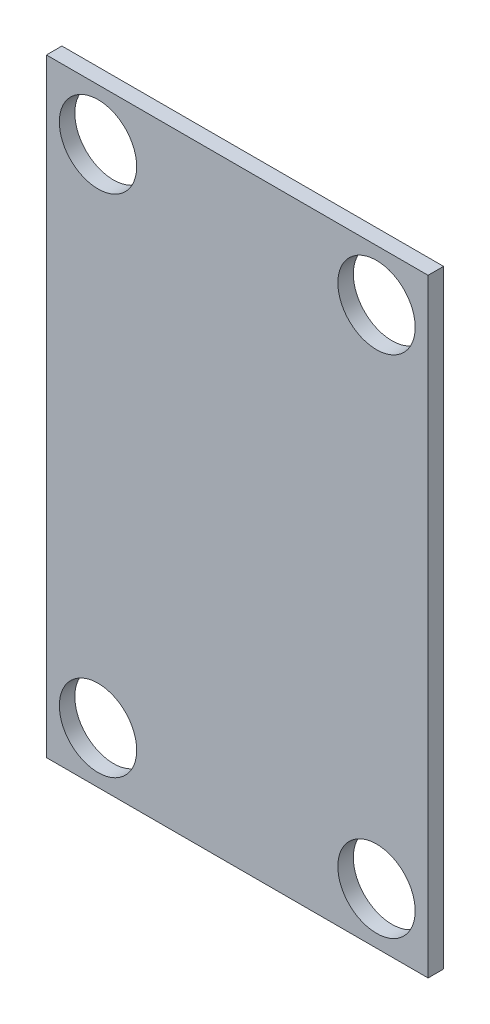
from build123d import *

# Parameters (mm, degrees)
SKETCH_1_W      = 37
SKETCH_1_H      = 59
SKETCH_1_R      = 3.75
EXTRUDE_1_DEPTH = 1.5


with BuildPart() as part:
    # Эскиз1 → Бобышка-Вытянуть1 (new body)
    with BuildSketch(Plane.XY):
        with Locations((0, -31)):
            Rectangle(SKETCH_1_W, SKETCH_1_H)
        with Locations((-13.5, -55.5)):
            Circle(SKETCH_1_R, mode=Mode.SUBTRACT)
        with Locations((13.5, -55.5)):
            Circle(SKETCH_1_R, mode=Mode.SUBTRACT)
        with Locations((13.5, -6.5)):
            Circle(SKETCH_1_R, mode=Mode.SUBTRACT)
        with Locations((-13.5, -6.5)):
            Circle(SKETCH_1_R, mode=Mode.SUBTRACT)
    extrude(amount=EXTRUDE_1_DEPTH)


solid = part.part
